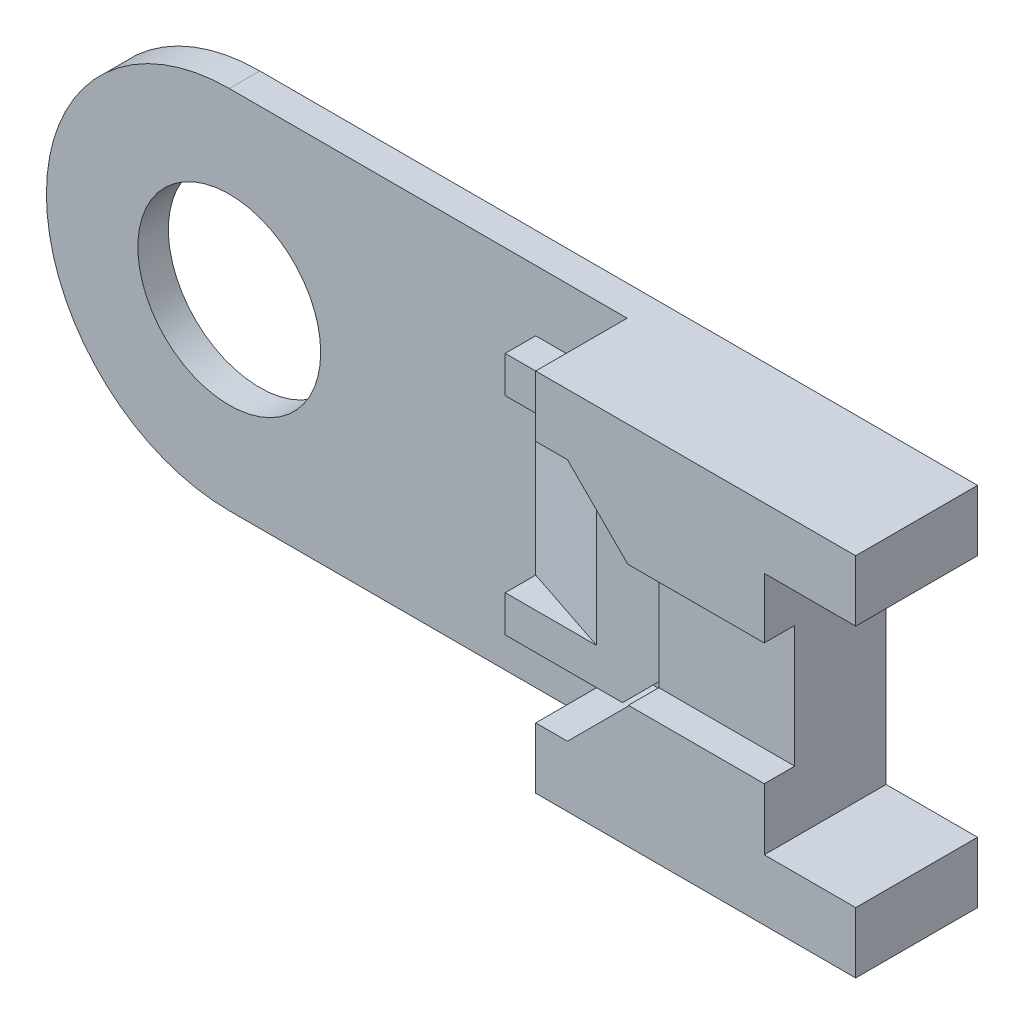
from build123d import *

# Parameters (mm, degrees)
SKETCH2_R               = 30
BOSS_EXTRUDE2_DEPTH     = 10
SKETCH4_W               = 39.74410588
SKETCH4_H               = 80
CUT_EXTRUDE1_DEPTH      = 30
SKETCH5_W               = 105
SKETCH5_H               = 120
BOSS_EXTRUDE3_DEPTH     = 40
SKETCH6_W               = 78.106224714
SKETCH6_H               = 80
CUT_EXTRUDE2_DEPTH      = 30
SKETCH7_W               = 45
SKETCH7_H               = 40
CUT_EXTRUDE3_DEPTH      = 10
CUT_EXTRUDE4_DEPTH      = 30
BOSS_EXTRUDE4_DEPTH     = 10
CUT_EXTRUDE5_DEPTH      = 1
CUT_EXTRUDE5_DEPTH_BACK = 68
SKETCH11_W              = 30
SKETCH11_H              = 10
BOSS_EXTRUDE8_DEPTH     = 12


with BuildPart() as part:
    # Sketch2 → Boss-Extrude2 (new body)
    with BuildSketch(Plane.XY):
        with BuildLine():
            Line((46.207044142, 120), (-84.343419201, 120))
            ThreePointArc((-84.343419201, 120), (-144.343419201, 60), (-84.343419201, 0))
            Line((-84.343419201, 0), (0, 0))
            Line((0, 0), (151.207044142, 0))
            Line((151.207044142, 0), (151.207044142, 120))
            Line((151.207044142, 120), (46.207044142, 120))
        make_face()
        with Locations((-84.343419201, 60)):
            Circle(SKETCH2_R, mode=Mode.SUBTRACT)
    extrude(amount=BOSS_EXTRUDE2_DEPTH)

    # Sketch4 → Cut-Extrude1 (cut)
    with BuildSketch(Plane(origin=(151.207044142, 0, 0), x_dir=(0, 0, -1), z_dir=(1, 0, 0))):
        with Locations((-1.423296347, 60)):
            Rectangle(SKETCH4_W, SKETCH4_H)
    extrude(amount=-CUT_EXTRUDE1_DEPTH, mode=Mode.SUBTRACT)

    # Sketch5 → Boss-Extrude3 (add)
    with BuildSketch(Plane.XY):
        with Locations((98.707044142, 60)):
            Rectangle(SKETCH5_W, SKETCH5_H)
    extrude(amount=BOSS_EXTRUDE3_DEPTH)

    # Sketch6 → Cut-Extrude2 (cut)
    with BuildSketch(Plane(origin=(151.207044142, 0, 0), x_dir=(0, 0, -1), z_dir=(1, 0, 0))):
        with Locations((-16.932746975, 60)):
            Rectangle(SKETCH6_W, SKETCH6_H)
    extrude(amount=-CUT_EXTRUDE2_DEPTH, mode=Mode.SUBTRACT)

    # Sketch7 → Cut-Extrude3 (cut)
    with BuildSketch(Plane.XY.offset(40)):
        with Locations((99.042729198, 60.209092216)):
            Rectangle(SKETCH7_W, SKETCH7_H)
    extrude(amount=-CUT_EXTRUDE3_DEPTH, mode=Mode.SUBTRACT)

    # Sketch8 → Cut-Extrude4 (cut)
    with BuildSketch(Plane.XY.offset(40)):
        Polygon((19.599086243, 100), (56.633635385, 100), (76.633635385, 80), (76.633635385, 40), (56.633635385, 20), (19.599086243, 20), align=None)
    extrude(amount=-CUT_EXTRUDE4_DEPTH, mode=Mode.SUBTRACT)

    # Sketch9 → Boss-Extrude4 (add)
    with BuildSketch(Plane.XY.offset(10)):
        Polygon((46.207044142, 100), (16.207044142, 100), (16.207044142, 20), (46.207044142, 20), (54.69343027, 20), (76.633635385, 41.940205115), (76.633635385, 80), (56.633635385, 100), align=None)
    extrude(amount=BOSS_EXTRUDE4_DEPTH)

    # Sketch10 → Cut-Extrude5 (cut, two sides: drawn at the far end of the back side and taken through both)
    with BuildSketch(Plane.XZ.offset(-20).offset(-CUT_EXTRUDE5_DEPTH_BACK)):
        Polygon((16.207044142, 10), (46.207044142, 20), (16.207044142, 20), align=None)
    extrude(amount=CUT_EXTRUDE5_DEPTH + CUT_EXTRUDE5_DEPTH_BACK, mode=Mode.SUBTRACT)

    # Sketch11 → Boss-Extrude8 (add)
    with BuildSketch(Plane.XZ.offset(-20)):
        with Locations((31.207044142, 15)):
            Rectangle(SKETCH11_W, SKETCH11_H)
    extrude(amount=-BOSS_EXTRUDE8_DEPTH)


solid = part.part
